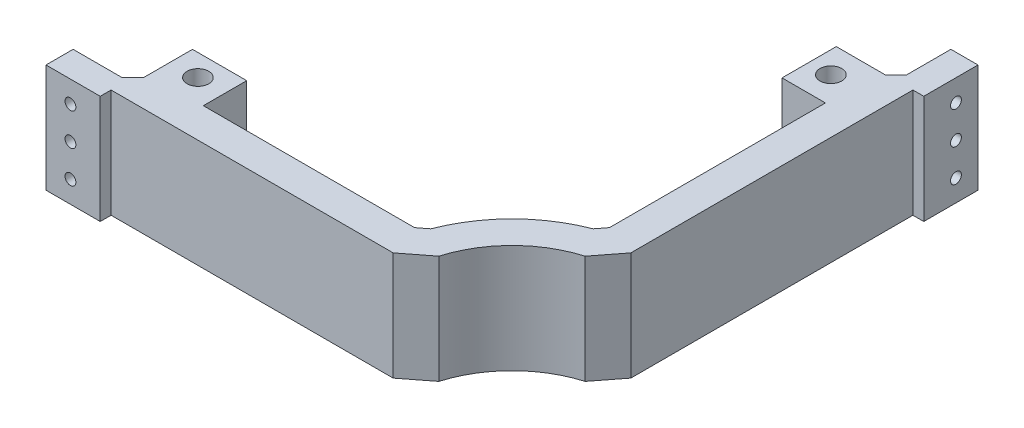
from build123d import *

# Parameters (mm, degrees)
BOSS_EXTRUDE1_DEPTH = 50
SKETCH3_R           = 5
CUT_EXTRUDE1_DEPTH  = 50
CHAMFER1_SIZE       = 5
CHAMFER2_SIZE       = 5
SKETCH4_R           = 2.5
CUT_EXTRUDE2_DEPTH  = 50
SKETCH5_R           = 2.5
CUT_EXTRUDE3_DEPTH  = 50


with BuildPart() as part:
    # Sketch2 → Boss-Extrude1 (new body)
    with BuildSketch(Plane(origin=(0, 0, 0), x_dir=(1, 0, 0), z_dir=(0, 1, 0))):
        with BuildLine():
            Line((-54.874212294, -102.775031025), (47.605671551, -102.775031025))
            Line((47.605671551, -102.775031025), (59.453092269, -93.575105898))
            ThreePointArc((59.453092269, -93.575105898), (72.038989389, -72.419691965), (93.194403322, -59.833794845))
            Line((93.194403322, -59.833794845), (102.394328449, -47.986374127))
            Line((102.394328449, -47.986374127), (102.394328449, 56.694970167))
            Line((102.394328449, 56.694970167), (102.394328449, 82.013625873))
            Line((102.394328449, 82.013625873), (107.394328449, 82.013625873))
            Line((107.394328449, 82.013625873), (107.394328449, 107.013625873))
            Line((107.394328449, 107.013625873), (94.894328449, 107.013625873))
            Line((94.894328449, 107.013625873), (94.894328449, 81.694970167))
            Line((94.894328449, 81.694970167), (67.394328449, 81.694970167))
            Line((67.394328449, 81.694970167), (67.394328449, 56.694970167))
            Line((67.394328449, 56.694970167), (87.394328449, 56.694970167))
            Line((87.394328449, 56.694970167), (87.394328449, -42.846257379))
            Line((87.394328449, -42.846257379), (84.095735231, -47.094098648))
            ThreePointArc((84.095735231, -47.094098648), (61.432387672, -61.813090248), (46.713396072, -84.476437807))
            Line((46.713396072, -84.476437807), (42.465554802, -87.775031025))
            Line((42.465554802, -87.775031025), (-54.874212294, -87.775031025))
            Line((-54.874212294, -87.775031025), (-54.874212294, -67.775031025))
            Line((-54.874212294, -67.775031025), (-79.874212294, -67.775031025))
            Line((-79.874212294, -67.775031025), (-79.874212294, -95.275031025))
            Line((-79.874212294, -95.275031025), (-107.394328449, -95.275031025))
            Line((-107.394328449, -95.275031025), (-107.394328449, -107.775031025))
            Line((-107.394328449, -107.775031025), (-82.394328449, -107.775031025))
            Line((-82.394328449, -107.775031025), (-82.394328449, -102.775031025))
            Line((-82.394328449, -102.775031025), (-54.874212294, -102.775031025))
        make_face()
    extrude(amount=BOSS_EXTRUDE1_DEPTH)

    # Sketch3 → Cut-Extrude1 (cut)
    with BuildSketch(Plane(origin=(0, 50, 0), x_dir=(1, 0, 0), z_dir=(0, 1, 0))):
        with Locations((77.394328449, 69.194970167)):
            Circle(SKETCH3_R)
        with Locations((-67.374212294, -77.775031025)):
            Circle(SKETCH3_R)
    extrude(amount=-CUT_EXTRUDE1_DEPTH, mode=Mode.SUBTRACT)

    # Chamfer1
    chamfer1_edges = [part.edges().sort_by_distance(p)[0] for p in [
        (94.894328449, 25, -81.694970167),
    ]]
    chamfer(chamfer1_edges, length=CHAMFER1_SIZE)

    # Chamfer2
    chamfer2_edges = [part.edges().sort_by_distance(p)[0] for p in [
        (-79.874212294, 25, 95.275031025),
    ]]
    chamfer(chamfer2_edges, length=CHAMFER2_SIZE)

    # Sketch4 → Cut-Extrude2 (cut)
    with BuildSketch(Plane.ZY.offset(-94.894328449)):
        with Locations((-96.85429802, 25)):
            Circle(SKETCH4_R)
        with Locations((-96.85429802, 40)):
            Circle(SKETCH4_R)
        with Locations((-96.85429802, 10)):
            Circle(SKETCH4_R)
    extrude(amount=-CUT_EXTRUDE2_DEPTH, mode=Mode.SUBTRACT)

    # Sketch5 → Cut-Extrude3 (cut)
    with BuildSketch(Plane(origin=(0, 0, 95.275031025), x_dir=(-1, 0, 0), z_dir=(0, 0, -1))):
        with Locations((96.134270371, 25)):
            Circle(SKETCH5_R)
        with Locations((96.134270371, 40)):
            Circle(SKETCH5_R)
        with Locations((96.134270371, 10)):
            Circle(SKETCH5_R)
    extrude(amount=-CUT_EXTRUDE3_DEPTH, mode=Mode.SUBTRACT)


solid = part.part
